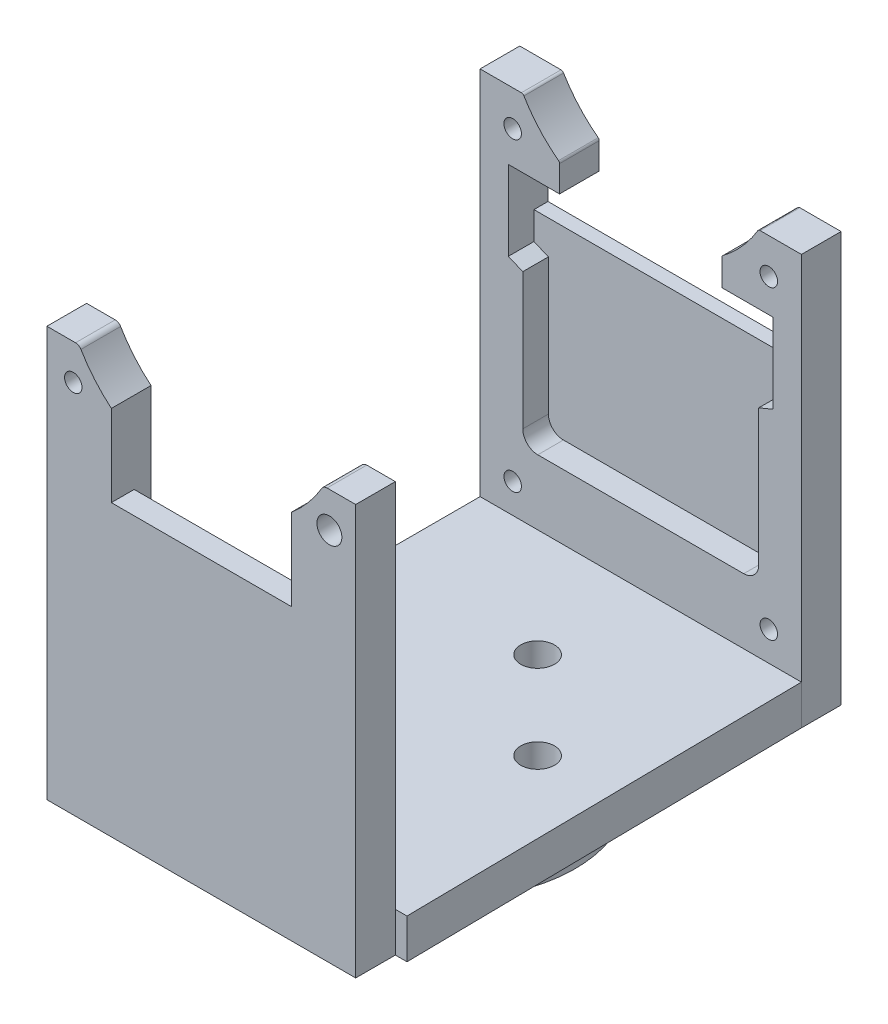
from build123d import *
from OCP.BRepAlgoAPI import BRepAlgoAPI_Cut
from OCP.TopTools import TopTools_ListOfShape

# Parameters (mm, degrees)
SKETCH1_R                 = 10
SKETCH1_R_2               = 1.35
BOSS_EXTRUDE1_DEPTH       = 3.175
SKETCH2_W                 = 38.058543228
SKETCH2_H                 = 41.75
SKETCH2_R                 = 1.35
BOSS_EXTRUDE2_DEPTH       = 3.175
SKETCH3_W                 = 38.058543228
SKETCH3_H                 = 41.75
SKETCH3_W_2               = 31.708543228
SKETCH3_H_2               = 35.4
BOSS_EXTRUDE3_DEPTH       = 20
FILLET1_R                 = 5
BOSS_EXTRUDE4_OUTLINE_R   = 1
BOSS_EXTRUDE4_OUTLINE_R_2 = 0.698520241
BOSS_EXTRUDE4_OUTLINE_R_3 = 0.699131638
BOSS_EXTRUDE4_DEPTH       = 4.524579022
SKETCH6_R                 = 0.699665004
SKETCH6_R_2               = 0.703272365
SKETCH6_R_3               = 0.700673295
SKETCH6_R_4               = 0.698053945
BOSS_EXTRUDE5_DEPTH       = 5.225420978
CUT_EXTRUDE3_DEPTH        = 39.629021569
CUT_EXTRUDE4_DEPTH        = 44.672508997


with BuildPart() as part:
    # Sketch1 → Boss-Extrude1 (new body)
    with BuildSketch(Plane(origin=(0, 0, 0), x_dir=(1, 0, 0), z_dir=(0, 1, 0))):
        with Locations(Location((0, 0, 0), (0, 0, 270))):
            Circle(SKETCH1_R)
        with Locations(Location((0, 7, 0), (0, 0, 270))):
            Circle(SKETCH1_R_2, mode=Mode.SUBTRACT)
        with Locations(Location((7, 0, 0), (0, 0, 270))):
            Circle(SKETCH1_R_2, mode=Mode.SUBTRACT)
        with Locations(Location((0, -7, 0), (0, 0, 270))):
            Circle(SKETCH1_R_2, mode=Mode.SUBTRACT)
        with Locations(Location((-7, 0, 0), (0, 0, 270))):
            Circle(SKETCH1_R_2, mode=Mode.SUBTRACT)
    extrude(amount=BOSS_EXTRUDE1_DEPTH)

    # Sketch2 → Boss-Extrude2 (add)
    with BuildSketch(Plane(origin=(0, 3.175, 0), x_dir=(1, 0, 0), z_dir=(0, 1, 0))):
        Rectangle(SKETCH2_W, SKETCH2_H)
        with Locations(Location((0, -7, 0), (0, 0, 270))):
            Circle(SKETCH2_R, mode=Mode.SUBTRACT)
        with Locations(Location((7, 0, 0), (0, 0, 270))):
            Circle(SKETCH2_R, mode=Mode.SUBTRACT)
        with Locations(Location((-7, 0, 0), (0, 0, 270))):
            Circle(SKETCH2_R, mode=Mode.SUBTRACT)
        with Locations(Location((0, 7, 0), (0, 0, 270))):
            Circle(SKETCH2_R, mode=Mode.SUBTRACT)
    extrude(amount=BOSS_EXTRUDE2_DEPTH)

    # Sketch3 → Boss-Extrude3 (add)
    with BuildSketch(Plane(origin=(0, 6.35, 0), x_dir=(1, 0, 0), z_dir=(0, 1, 0))):
        Rectangle(SKETCH3_W, SKETCH3_H)
        Rectangle(SKETCH3_W_2, SKETCH3_H_2, mode=Mode.SUBTRACT)
    extrude(amount=BOSS_EXTRUDE3_DEPTH)

    # Fillet1
    fillet1_edges = [part.edges().sort_by_distance(p)[0] for p in [
        (-19.029271614, 14.7625, -20.875),
        (-19.029271614, 14.7625, 20.875),
        (19.029271614, 14.7625, 20.875),
        (19.029271614, 14.7625, -20.875),
    ]]
    fillet(fillet1_edges, radius=FILLET1_R)

    # Boss-Extrude4: read off the stored shape, not the designer's step
    # Boss-Extrude4 outline → Boss-Extrude4 (add)
    # profile 1 of 2: a face of its own
    with BuildSketch(Plane.XY.offset(16.350420978)):
        with BuildLine():
            ThreePointArc((9.674791631, 35.998523082), (9.427181956, 35.932908065), (9.244559074, 35.753284112))
            ThreePointArc((9.244559074, 35.753284112), (8.147643376, 34.213929311), (6.807481387, 32.880961337))
            Line((6.807481387, 32.880961337), (6.807482447, 6.35))
            Line((6.807482447, 6.35), (11.963760646, 6.35))
            Line((11.963760646, 6.35), (11.963760646, 35.998520144))
            Line((11.963760646, 35.998520144), (9.674791631, 35.998523082))
        make_face()
        with Locations((9.857482447, 33.16)):
            Circle(BOSS_EXTRUDE4_OUTLINE_R, mode=Mode.SUBTRACT)
        with Locations((9.857482447, 12.46)):
            Circle(BOSS_EXTRUDE4_OUTLINE_R, mode=Mode.SUBTRACT)
    # profile 2 of 2: a face of its own
    with BuildSketch(Plane.XY.offset(16.350420978)):
        with BuildLine():
            Line((-12.751066043, 35.998520144), (-12.751066043, 6.35))
            Line((-12.751066043, 6.35), (-7.592517553, 6.35))
            Line((-7.592517553, 6.35), (-7.592516964, 32.880958857))
            ThreePointArc((-7.592516964, 32.880958857), (-8.932679762, 34.213927416), (-10.029597495, 35.753282149))
            ThreePointArc((-10.029597495, 35.753282149), (-10.212218516, 35.932905514), (-10.459826737, 35.998520144))
            Line((-10.459826737, 35.998520144), (-12.751066043, 35.998520144))
        make_face()
        with Locations((-10.642517553, 33.16)):
            Circle(BOSS_EXTRUDE4_OUTLINE_R_2, mode=Mode.SUBTRACT)
        with Locations((-10.642517553, 12.46)):
            Circle(BOSS_EXTRUDE4_OUTLINE_R_3, mode=Mode.SUBTRACT)
    extrude(amount=BOSS_EXTRUDE4_DEPTH)

    # Sketch6 → Boss-Extrude5 (add)
    with BuildSketch(Plane(origin=(0, 0, -15.649579022), x_dir=(-1, 0, 0), z_dir=(0, 0, -1))):
        with BuildLine():
            Line((10.992517553, 24.135), (10.992517553, 30.51))
            Line((10.992517553, 30.51), (7.192517366, 30.510000072))
            Line((7.192517366, 30.510000072), (6.892517553, 30.510000072))
            Line((6.892517553, 30.510000072), (6.892517553, 32.612557612))
            add(Edge.make_bspline(
                [(6.975743415, 32.783855976), (6.958921233, 32.771091761), (6.928542383, 32.73934935), (6.899316538, 32.679660552), (6.892517469, 32.634957243), (6.892517553, 32.612557612)],
                knots=[1.062e-06, 1.062e-06, 1.062e-06, 1.062e-06, 0.322323684, 0.658094096, 1, 1, 1, 1], degree=3, weights=[1, 1, 1, 1, 1, 1]))
            ThreePointArc((6.975743415, 32.783855976), (8.509170356, 34.198162413), (9.744817778, 35.878887355))
            add(Edge.make_bspline(
                [(9.950114528, 35.998516481), (9.923391157, 35.998516414), (9.869066225, 35.989019468), (9.796326784, 35.947026629), (9.759487209, 35.903468994), (9.744817778, 35.878887355)],
                knots=[0, 0, 0, 0, 0.324047023, 0.652881456, 1, 1, 1, 1], degree=3, weights=[1, 1, 1, 1, 1, 1]))
            Line((9.950114528, 35.998516481), (11.752517552, 35.998516481))
            Line((11.752517552, 35.998516481), (13.252517552, 35.998516481))
            Line((13.252517552, 35.998516481), (13.252517552, 6.318190736))
            Line((13.252517552, 6.318190736), (-12.46748245, 6.318190736))
            Line((-12.46748245, 6.318190736), (-12.46748245, 35.998516481))
            Line((-12.46748245, 35.998516481), (-10.96748245, 35.998516481))
            Line((-10.96748245, 35.998516481), (-9.165078771, 35.998516481))
            add(Edge.make_bspline(
                [(-8.959782959, 35.878887832), (-8.974454973, 35.903473814), (-9.011299786, 35.947034481), (-9.084041461, 35.989022268), (-9.138360889, 35.998516579), (-9.165078771, 35.998516481)],
                knots=[3.25e-07, 3.25e-07, 3.25e-07, 3.25e-07, 0.347182134, 0.676017862, 1, 1, 1, 1], degree=3, weights=[1, 1, 1, 1, 1, 1]))
            ThreePointArc((-8.959782959, 35.878887832), (-7.72413548, 34.198162669), (-6.190708414, 32.783856055))
            add(Edge.make_bspline(
                [(-6.107482447, 32.612555023), (-6.107481996, 32.634920643), (-6.114271613, 32.679614721), (-6.143476784, 32.739319032), (-6.173880837, 32.77108775), (-6.190708414, 32.783856055)],
                knots=[0, 0, 0, 0, 0.341381322, 0.677579946, 1, 1, 1, 1], degree=3, weights=[1, 1, 1, 1, 1, 1]))
            Line((-6.107482447, 32.612555023), (-6.107482447, 30.510000072))
            Line((-6.107482447, 30.510000072), (-6.407482262, 30.510000072))
            Line((-6.407482262, 30.510000072), (-10.207482447, 30.51))
            Line((-10.207482447, 30.51), (-10.207482447, 24.135))
            Line((-10.207482447, 24.135), (-9.049769141, 23.654765682))
            Line((-9.049769141, 23.654765682), (-9.049769141, 12.756914674))
            ThreePointArc((-9.049769141, 12.756914674), (-8.698297278, 11.908386539), (-7.849769141, 11.556914678))
            Line((-7.849769141, 11.556914678), (8.634804248, 11.556914678))
            ThreePointArc((8.634804248, 11.556914678), (9.483332385, 11.908386541), (9.834804247, 12.756914678))
            Line((9.834804247, 12.756914678), (9.834804247, 23.654765682))
            Line((9.834804247, 23.654765682), (10.992517553, 24.135))
        make_face()
        with Locations(Location((-9.857482447, 8.71, 0), (0, 0, 180))):
            Circle(SKETCH6_R, mode=Mode.SUBTRACT)
        with Locations(Location((-9.857482447, 33.16, 0), (0, 0, 180))):
            Circle(SKETCH6_R_2, mode=Mode.SUBTRACT)
        with Locations(Location((10.642517553, 33.16, 0), (0, 0, 180))):
            Circle(SKETCH6_R_3, mode=Mode.SUBTRACT)
        with Locations(Location((10.642517553, 8.71, 0), (0, 0, 180))):
            Circle(SKETCH6_R_4, mode=Mode.SUBTRACT)
    extrude(amount=BOSS_EXTRUDE5_DEPTH)

    # Sketch7 → Cut-Extrude3 (cut, through all)
    with BuildSketch(Plane(origin=(0, 26.35, 0), x_dir=(1, 0, 0), z_dir=(0, 1, 0))):
        Polygon((11.963760646, -16.350420978), (11.963760646, -22.528007323), (30.022930958, -23.761888284), (27.696884363, 28.84716935), (12.46748245, 20.875), (12.46748245, 15.649579022), (12.894365171, -16.350420978), align=None)
        Polygon((-12.751066043, -16.350420978), (-12.751066043, -23.761888284), (-21.517724294, -22.528007323), (-21.901635858, 22.206155736), (-13.252517552, 20.875), (-13.252517552, -16.350420978), align=None)
    extrude(amount=-CUT_EXTRUDE3_DEPTH, mode=Mode.SUBTRACT)


with BuildPart() as cut_extrude4_tool:
    # Sketch9 → Cut-Extrude4 (new, through all)
    with BuildSketch(Plane(origin=(-2e-09, 35.998516482, 0), x_dir=(1.0, 6.10309035182258e-11, 0), z_dir=(-6.10309035182258e-11, 1.0, -1.0368003232160358e-14))):
        Polygon((-12.751066041, -19.525420978), (13.891993445, -19.525420978), (13.555046053, -22.524424576), (-19.185008861, -22.524424576), align=None)
        Polygon((-13.25251755, 18.824579022), (15.127467216, 18.824579022), (13.105782864, 23.749676422), (-20.139693138, 23.131939537), align=None)
    extrude(amount=-CUT_EXTRUDE4_DEPTH)


with BuildPart() as part_1:
    add(part.part)

    # Cut-Extrude4: cut by cut_extrude4_tool, with a tolerance
    cut_extrude4_stock = TopTools_ListOfShape()
    cut_extrude4_stock.Append(part_1.part.wrapped)
    cut_extrude4_tools = TopTools_ListOfShape()
    cut_extrude4_tools.Append(cut_extrude4_tool.part.wrapped)
    cut_extrude4_cut = BRepAlgoAPI_Cut()
    cut_extrude4_cut.SetArguments(cut_extrude4_stock)
    cut_extrude4_cut.SetTools(cut_extrude4_tools)
    cut_extrude4_cut.SetFuzzyValue(0.00001)
    cut_extrude4_cut.Build()
    add(Compound.cast(cut_extrude4_cut.Shape()).solids(), mode=Mode.REPLACE)


solid = part_1.part
